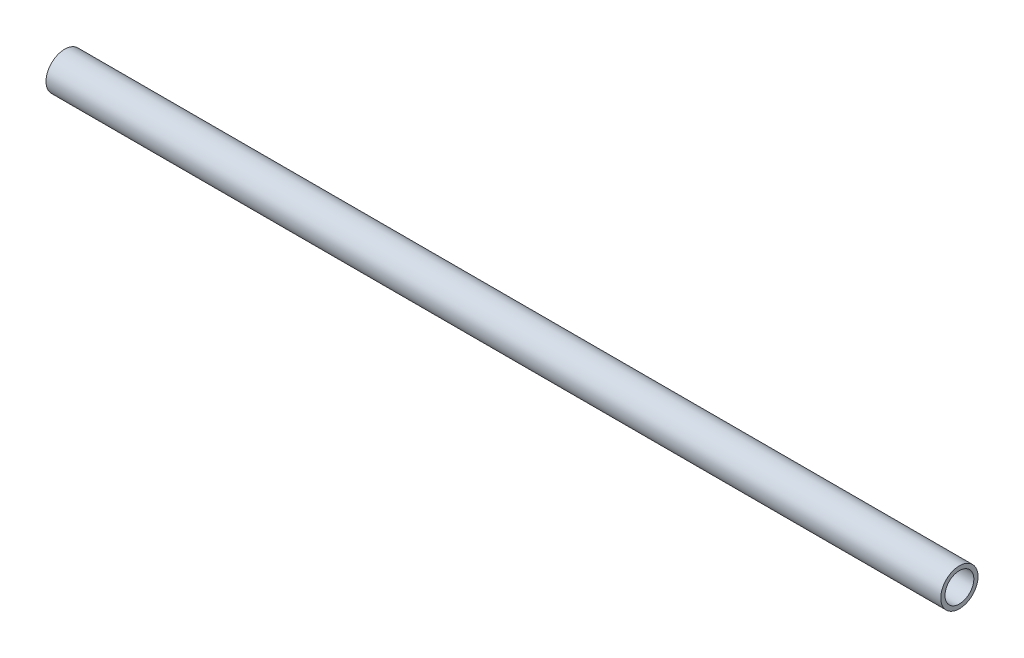
from build123d import *

# Parameters (mm, degrees)
SKETCH2_R           = 12.7
SKETCH2_R_2         = 9.8298
BOSS_EXTRUDE1_DEPTH = 609.6


with BuildPart() as part:
    # Sketch2 → Boss-Extrude1 (new body)
    with BuildSketch(Plane(origin=(0, 0, 0), x_dir=(0, 0, -1), z_dir=(1, 0, 0))):
        Circle(SKETCH2_R)
        Circle(SKETCH2_R_2, mode=Mode.SUBTRACT)
    extrude(amount=BOSS_EXTRUDE1_DEPTH)


solid = part.part
